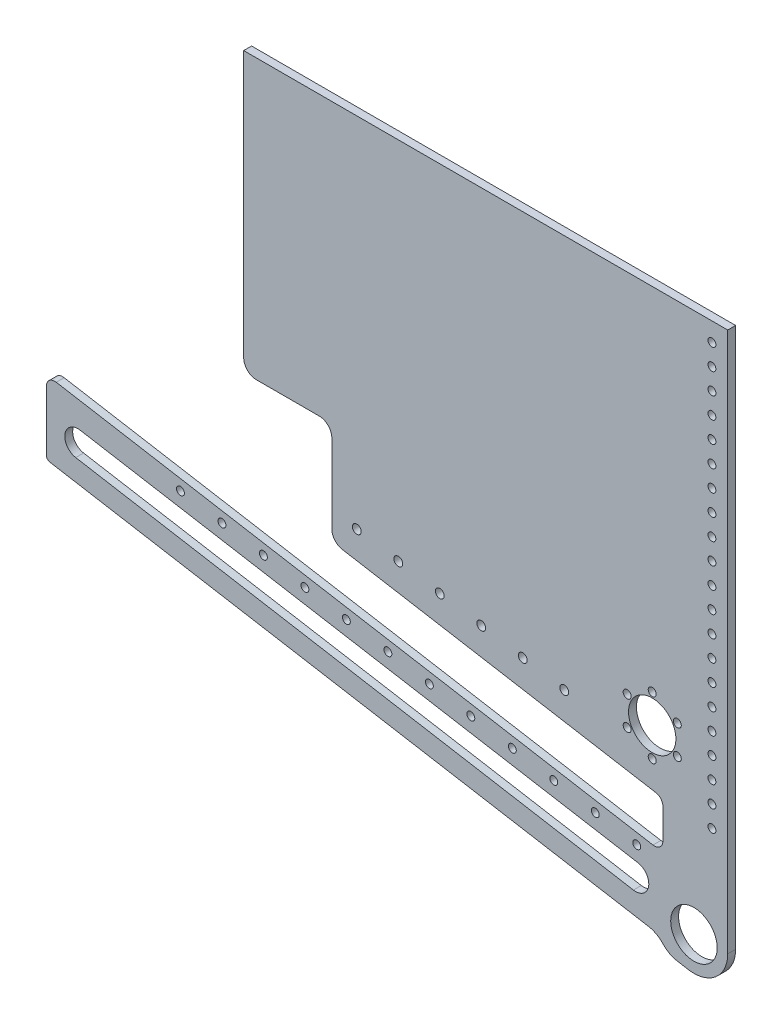
from build123d import *

# Parameters (mm, degrees)
SKETCH1_R           = 14.0335
SKETCH1_R_2         = 2.38125
SKETCH1_R_3         = 14.2875
SKETCH1_R_4         = 2.413
SKETCH1_R_5         = 2.667
BOSS_EXTRUDE1_DEPTH = 4.7625


with BuildPart() as part:
    # Sketch1 → Boss-Extrude1 (new body)
    with BuildSketch(Plane.XY):
        with BuildLine():
            Line((165.542350471, -12.850928795), (158.864493489, -11.70515089))
            ThreePointArc((158.864493489, -11.70515089), (154.154566121, -10.06953751), (150.224583517, -7.001332225))
            ThreePointArc((150.224583517, -7.001332225), (146.294597206, -3.933124046), (141.584665397, -2.297509122))
            Line((141.584665397, -2.297509122), (-219.697182678, 59.690754476))
            ThreePointArc((-219.697182678, 59.690754476), (-221.209634879, 60.557012384), (-221.807649529, 62.194172394))
            Line((-221.807649529, 62.194172394), (-221.807649529, 98.384220964))
            ThreePointArc((-221.807649529, 98.384220964), (-220.001969551, 102.268191663), (-215.868583232, 103.3910568))
            Line((-215.868583232, 103.3910568), (107.376757829, 47.929046973))
            Line((107.376757829, 47.929046973), (144.285517219, 41.596290654))
            ThreePointArc((144.285517219, 41.596290654), (148.418903539, 42.719155791), (150.224583517, 46.603126491))
            Line((150.224583517, 46.603126491), (150.224583517, 64.831428553))
            ThreePointArc((150.224583517, 64.831428553), (149.028554217, 68.105748575), (146.003649815, 69.83826439))
            Line((146.003649815, 69.83826439), (-43.218335812, 102.304723433))
            ThreePointArc((-43.218335812, 102.304723433), (-47.755692415, 104.903497156), (-49.549736366, 109.814977189))
            Line((-49.549736366, 109.814977189), (-49.549736366, 157.457180393))
            ThreePointArc((-49.549736366, 157.457180393), (-51.781582693, 162.845334066), (-57.169736366, 165.077180393))
            Line((-57.169736366, 165.077180393), (-95.10714601, 165.077180393))
            ThreePointArc((-95.10714601, 165.077180393), (-100.495299682, 167.309026721), (-102.72714601, 172.697180393))
            Line((-102.72714601, 172.697180393), (-102.72714601, 333.30748602))
            Line((-102.72714601, 333.30748602), (189.37285399, 333.30748602))
            Line((189.37285399, 333.30748602), (189.37285399, 131.560051298))
            Line((189.37285399, 131.560051298), (189.37285399, 7.239))
            ThreePointArc((189.37285399, 7.239), (182.127563077, -8.345432433), (165.542350471, -12.850928795))
        make_face()
        with Locations((168.98935399, 7.239)):
            Circle(SKETCH1_R, mode=Mode.SUBTRACT)
        with Locations((179.847857475, 118.860051298)):
            Circle(SKETCH1_R_2, mode=Mode.SUBTRACT)
        with Locations((179.847857475, 106.160051298)):
            Circle(SKETCH1_R_2, mode=Mode.SUBTRACT)
        with Locations((179.847857475, 93.460051298)):
            Circle(SKETCH1_R_2, mode=Mode.SUBTRACT)
        with Locations((179.847857475, 80.760051298)):
            Circle(SKETCH1_R_2, mode=Mode.SUBTRACT)
        with Locations((179.847857475, 68.060051298)):
            Circle(SKETCH1_R_2, mode=Mode.SUBTRACT)
        with Locations((109.44968796, 41.130584726)):
            Circle(SKETCH1_R_2, mode=Mode.SUBTRACT)
        with Locations((84.415508776, 45.425916214)):
            Circle(SKETCH1_R_2, mode=Mode.SUBTRACT)
        with Locations((59.381329592, 49.721247702)):
            Circle(SKETCH1_R_2, mode=Mode.SUBTRACT)
        with Locations((34.347150409, 54.016579191)):
            Circle(SKETCH1_R_2, mode=Mode.SUBTRACT)
        with Locations((9.312971225, 58.311910679)):
            Circle(SKETCH1_R_2, mode=Mode.SUBTRACT)
        with Locations((-15.721207959, 62.607242167)):
            Circle(SKETCH1_R_2, mode=Mode.SUBTRACT)
        with Locations((-40.755387143, 66.902573656)):
            Circle(SKETCH1_R_2, mode=Mode.SUBTRACT)
        with Locations((-65.789566327, 71.197905144)):
            Circle(SKETCH1_R_2, mode=Mode.SUBTRACT)
        with Locations((-90.82374551, 75.493236632)):
            Circle(SKETCH1_R_2, mode=Mode.SUBTRACT)
        with Locations((-115.857924694, 79.788568121)):
            Circle(SKETCH1_R_2, mode=Mode.SUBTRACT)
        with Locations((-140.892103878, 84.083899609)):
            Circle(SKETCH1_R_2, mode=Mode.SUBTRACT)
        with Locations((134.483867144, 36.835253237)):
            Circle(SKETCH1_R_2, mode=Mode.SUBTRACT)
        with Locations((143.80981943, 103.921008836)):
            Circle(SKETCH1_R_3, mode=Mode.SUBTRACT)
        with Locations((143.80981943, 121.383508836)):
            Circle(SKETCH1_R_4, mode=Mode.SUBTRACT)
        with Locations((158.932788044, 112.652258836)):
            Circle(SKETCH1_R_4, mode=Mode.SUBTRACT)
        with Locations((158.932788044, 95.189758836)):
            Circle(SKETCH1_R_4, mode=Mode.SUBTRACT)
        with Locations((143.80981943, 86.458508836)):
            Circle(SKETCH1_R_4, mode=Mode.SUBTRACT)
        with Locations((128.686850817, 95.189758836)):
            Circle(SKETCH1_R_4, mode=Mode.SUBTRACT)
        with Locations((128.686850817, 112.652258836)):
            Circle(SKETCH1_R_4, mode=Mode.SUBTRACT)
        with Locations((179.847857475, 131.560051298)):
            Circle(SKETCH1_R_2, mode=Mode.SUBTRACT)
        with Locations((179.847857475, 144.260051298)):
            Circle(SKETCH1_R_2, mode=Mode.SUBTRACT)
        with Locations((179.847857475, 156.960051298)):
            Circle(SKETCH1_R_2, mode=Mode.SUBTRACT)
        with Locations((179.847857475, 169.660051298)):
            Circle(SKETCH1_R_2, mode=Mode.SUBTRACT)
        with Locations((179.847857475, 182.360051298)):
            Circle(SKETCH1_R_2, mode=Mode.SUBTRACT)
        with Locations((179.847857475, 195.060051298)):
            Circle(SKETCH1_R_2, mode=Mode.SUBTRACT)
        with Locations((179.847857475, 207.760051298)):
            Circle(SKETCH1_R_2, mode=Mode.SUBTRACT)
        with Locations((179.847857475, 220.460051298)):
            Circle(SKETCH1_R_2, mode=Mode.SUBTRACT)
        with Locations((179.847857475, 233.160051298)):
            Circle(SKETCH1_R_2, mode=Mode.SUBTRACT)
        with Locations((179.847857475, 245.860051298)):
            Circle(SKETCH1_R_2, mode=Mode.SUBTRACT)
        with Locations((179.847857475, 258.560051298)):
            Circle(SKETCH1_R_2, mode=Mode.SUBTRACT)
        with Locations((179.847857475, 271.260051298)):
            Circle(SKETCH1_R_2, mode=Mode.SUBTRACT)
        with Locations((179.847857475, 283.960051298)):
            Circle(SKETCH1_R_2, mode=Mode.SUBTRACT)
        with Locations((179.847857475, 296.660051298)):
            Circle(SKETCH1_R_2, mode=Mode.SUBTRACT)
        with Locations((179.847857475, 309.360051298)):
            Circle(SKETCH1_R_2, mode=Mode.SUBTRACT)
        with Locations((179.847857475, 322.060051298)):
            Circle(SKETCH1_R_2, mode=Mode.SUBTRACT)
        with Locations((-9.432735227, 113.017786349)):
            Circle(SKETCH1_R_5, mode=Mode.SUBTRACT)
        with Locations((15.601656952, 108.723696433)):
            Circle(SKETCH1_R_5, mode=Mode.SUBTRACT)
        with Locations((40.636049132, 104.429606517)):
            Circle(SKETCH1_R_5, mode=Mode.SUBTRACT)
        with Locations((65.670441311, 100.135516602)):
            Circle(SKETCH1_R_5, mode=Mode.SUBTRACT)
        with Locations((90.704833491, 95.841426686)):
            Circle(SKETCH1_R_5, mode=Mode.SUBTRACT)
        with Locations((-34.467127407, 117.311876264)):
            Circle(SKETCH1_R_5, mode=Mode.SUBTRACT)
        with BuildLine():
            Line((132.450059381, 12.155377797), (-204.099940619, 69.90018348))
            ThreePointArc((-204.099940619, 69.90018348), (-210.580830524, 79.065655565), (-201.415358439, 85.54654547))
            Line((-201.415358439, 85.54654547), (135.134641561, 27.801739787))
            ThreePointArc((135.134641561, 27.801739787), (141.615531466, 18.636267702), (132.450059381, 12.155377797))
        make_face(mode=Mode.SUBTRACT)
    extrude(amount=BOSS_EXTRUDE1_DEPTH)


solid = part.part
